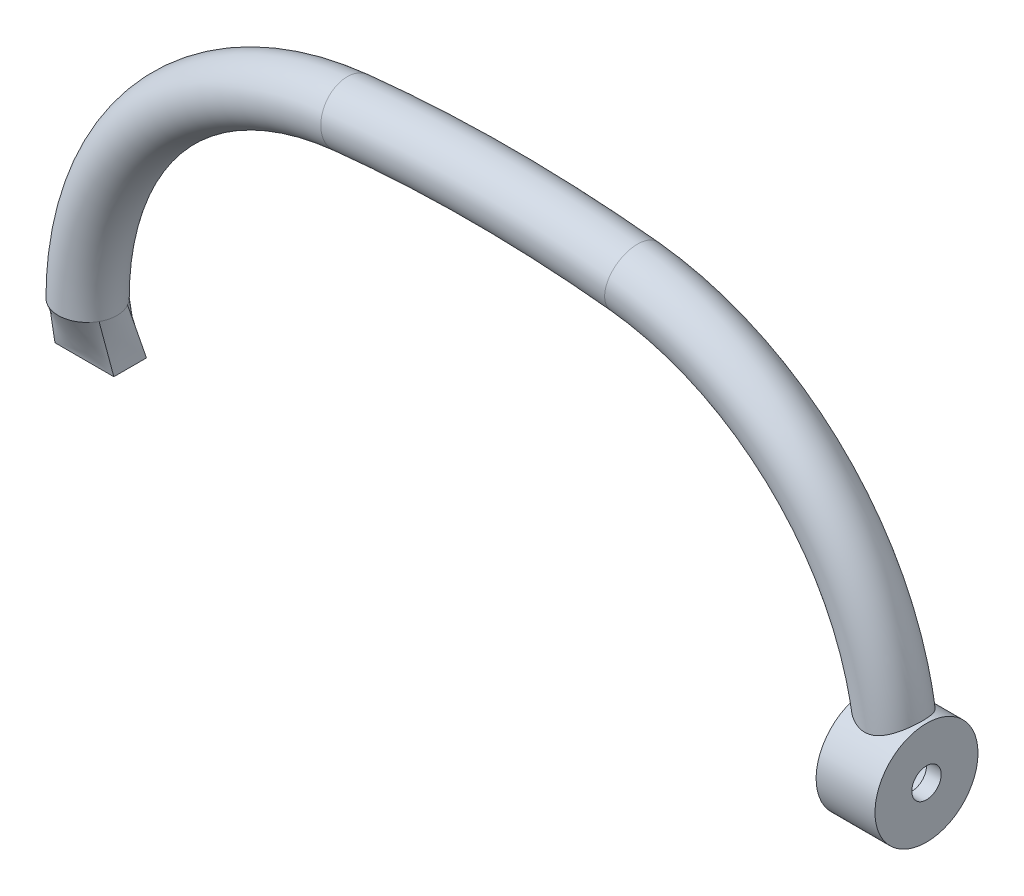
from build123d import *

# Parameters (mm, degrees)
ESQUISSE2_R                  = 2
BOSS_EXTRU_1_START           = 18
ESQUISSE3_R                  = 3.5
BOSS_EXTRU_1_DEPTH           = 4
ESQUISSE4_R                  = 1
ENL_V_MAT_EXTRU_1_DEPTH      = 4
ENL_V_MAT_EXTRU_2_DEPTH      = 3
ENL_V_MAT_EXTRU_2_DEPTH_BACK = 3
ESQUISSE5_R                  = 2.5


with BuildPart() as part:
    # Balayage1: sweep along a path in Esquisse1
    with BuildLine(Plane.XY) as balayage1_path:
        ThreePointArc((20, 0), (14.880476183, 13.363062096), (2.142857143, 19.884872724))
        ThreePointArc((2.142857143, 19.884872724), (-7.5, 20.402945465), (-17.142857143, 19.884872724))
        ThreePointArc((-17.142857143, 19.884872724), (-29.880476183, 13.363062096), (-35, 0))
    # Esquisse2 → Balayage1 (sweep)
    with BuildSketch(Plane(origin=(0, 0, 0), x_dir=(1, 0, 0), z_dir=(0, 1, 0))):
        with Locations((-35, 0)):
            Circle(ESQUISSE2_R)
    sweep(path=balayage1_path.line)

    # Esquisse3 → Boss.-Extru.1 (add)
    with BuildSketch(Plane(origin=(0, 0, 0), x_dir=(0, 0, -1), z_dir=(1, 0, 0)).offset(BOSS_EXTRU_1_START)):
        with Locations(Location((0, 0, 0), (0, 0, 107.690863125))):
            Circle(ESQUISSE3_R)
    extrude(amount=BOSS_EXTRU_1_DEPTH)

    # Esquisse4 → Enlèv. mat.-Extru.1 (cut)
    with BuildSketch(Plane(origin=(22, 0, 0), x_dir=(0, 0, -1), z_dir=(1, 0, 0))):
        Circle(ESQUISSE4_R)
    extrude(amount=-ENL_V_MAT_EXTRU_1_DEPTH, mode=Mode.SUBTRACT)

    # Esquisse5 → Enlèv. mat.-Extru.2 (cut, two sides: drawn at the far end of the back side and taken through both)
    with BuildSketch(Plane.ZY.offset(-18).offset(-ENL_V_MAT_EXTRU_2_DEPTH_BACK)):
        with Locations(Location((0, 0, 0), (0, 0, 108.058622976))):
            Circle(ESQUISSE5_R)
    extrude(amount=ENL_V_MAT_EXTRU_2_DEPTH + ENL_V_MAT_EXTRU_2_DEPTH_BACK, mode=Mode.SUBTRACT)

    # Lissage1: read off the stored shape, not the designer's step
    # Lissage1: loft between two sections, ruled curve by curve
    lissage1_from = [
        Edge.make_bspline([(-36.749469355, 0, -0.969204301), (-36.678819637, 0, -1.096731094), (-36.589454865, 0, -1.225003052), (-36.368205496, 0, -1.467996241), (-36.236155441, 0, -1.582585979), (-35.932449234, 0, -1.778537905), (-35.760757814, 0, -1.859623663), (-35.392626028, 0, -1.97048152), (-35.196401592, 0, -2), (-34.803598408, 0, -2), (-34.607373972, 0, -1.97048152), (-34.239242186, 0, -1.859623663), (-34.067550766, 0, -1.778537905), (-33.763844559, 0, -1.582585979), (-33.631794504, 0, -1.467996241), (-33.410545135, 0, -1.225003052), (-33.321180363, 0, -1.096731094), (-33.250530645, 0, -0.969204301)], [0, 0, 0, 0, 0.125, 0.125, 0.25, 0.25, 0.375, 0.375, 0.5, 0.5, 0.625, 0.625, 0.75, 0.75, 0.875, 0.875, 1, 1, 1, 1], 3),
        Edge.make_bspline([(-33.250530645, 0, -0.969204301), (-33.172250897, 0, -0.827904866), (-33.108813179, 0, -0.672414541), (-33.022626455, 0, -0.344561707), (-33, 0, -0.172327372), (-33, 0, 0.172327372), (-33.022626455, 0, 0.344561707), (-33.108813179, 0, 0.672414541), (-33.172250897, 0, 0.827904866), (-33.250530645, 0, 0.969204301)], [0, 0, 0, 0, 0.25, 0.25, 0.5, 0.5, 0.75, 0.75, 1, 1, 1, 1], 3),
        Edge.make_bspline([(-36.749469355, 0, 0.969204301), (-36.827749103, 0, 0.827904866), (-36.891186821, 0, 0.672414541), (-36.977373545, 0, 0.344561707), (-37, 0, 0.172327372), (-37, 0, -0.172327372), (-36.977373545, 0, -0.344561707), (-36.891186821, 0, -0.672414541), (-36.827749103, 0, -0.827904866), (-36.749469355, 0, -0.969204301)], [0, 0, 0, 0, 0.25, 0.25, 0.5, 0.5, 0.75, 0.75, 1, 1, 1, 1], 3),
        Edge.make_bspline([(-33.250530645, 0, 0.969204301), (-33.321180363, 0, 1.096731094), (-33.410545135, 0, 1.225003052), (-33.631794504, 0, 1.467996241), (-33.763844559, 0, 1.582585979), (-34.067550766, 0, 1.778537905), (-34.239242186, 0, 1.859623663), (-34.607373972, 0, 1.97048152), (-34.803598408, 0, 2), (-35.196401592, 0, 2), (-35.392626028, 0, 1.97048152), (-35.760757814, 0, 1.859623663), (-35.932449234, 0, 1.778537905), (-36.236155441, 0, 1.582585979), (-36.368205496, 0, 1.467996241), (-36.589454865, 0, 1.225003052), (-36.678819637, 0, 1.096731094), (-36.749469355, 0, 0.969204301)], [0, 0, 0, 0, 0.125, 0.125, 0.25, 0.25, 0.375, 0.375, 0.5, 0.5, 0.625, 0.625, 0.75, 0.75, 0.875, 0.875, 1, 1, 1, 1], 3),
    ]
    lissage1_to = [
        Edge.make_bspline([(-37, -3.5, -2), (-36.833333333, -3.5, -2), (-36.666666667, -3.5, -2), (-36.333333333, -3.5, -2), (-36.166666667, -3.5, -2), (-35.833333333, -3.5, -2), (-35.666666667, -3.5, -2), (-35.333333333, -3.5, -2), (-35.166666667, -3.5, -2), (-34.833333333, -3.5, -2), (-34.666666667, -3.5, -2), (-34.333333333, -3.5, -2), (-34.166666667, -3.5, -2), (-33.833333333, -3.5, -2), (-33.666666667, -3.5, -2), (-33.333333333, -3.5, -2), (-33.166666667, -3.5, -2), (-33, -3.5, -2)], [0, 0, 0, 0, 0.125, 0.125, 0.25, 0.25, 0.375, 0.375, 0.5, 0.5, 0.625, 0.625, 0.75, 0.75, 0.875, 0.875, 1, 1, 1, 1], 3),
        Edge.make_bspline([(-33, -3.5, -2), (-33, -3.5, -1.815333661), (-33, -3.5, -1.630667323), (-33, -3.5, -1.261334645), (-33, -3.5, -1.076668307), (-33, -3.5, -0.707335629), (-33, -3.5, -0.52266929), (-33, -3.5, -0.153336613), (-33, -3.5, 0.031329726), (-33, -3.5, 0.215996064)], [0, 0, 0, 0, 0.25, 0.25, 0.5, 0.5, 0.75, 0.75, 1, 1, 1, 1], 3),
        Edge.make_bspline([(-37, -3.5, 0.215996064), (-37, -3.5, 0.031329726), (-37, -3.5, -0.153336613), (-37, -3.5, -0.52266929), (-37, -3.5, -0.707335629), (-37, -3.5, -1.076668307), (-37, -3.5, -1.261334645), (-37, -3.5, -1.630667323), (-37, -3.5, -1.815333661), (-37, -3.5, -2)], [0, 0, 0, 0, 0.25, 0.25, 0.5, 0.5, 0.75, 0.75, 1, 1, 1, 1], 3),
        Edge.make_bspline([(-33, -3.5, 0.215996064), (-33.166666667, -3.5, 0.215996064), (-33.333333333, -3.5, 0.215996064), (-33.666666667, -3.5, 0.215996064), (-33.833333333, -3.5, 0.215996064), (-34.166666667, -3.5, 0.215996064), (-34.333333333, -3.5, 0.215996064), (-34.666666667, -3.5, 0.215996064), (-34.833333333, -3.5, 0.215996064), (-35.166666667, -3.5, 0.215996064), (-35.333333333, -3.5, 0.215996064), (-35.666666667, -3.5, 0.215996064), (-35.833333333, -3.5, 0.215996064), (-36.166666667, -3.5, 0.215996064), (-36.333333333, -3.5, 0.215996064), (-36.666666667, -3.5, 0.215996064), (-36.833333333, -3.5, 0.215996064), (-37, -3.5, 0.215996064)], [0, 0, 0, 0, 0.125, 0.125, 0.25, 0.25, 0.375, 0.375, 0.5, 0.5, 0.625, 0.625, 0.75, 0.75, 0.875, 0.875, 1, 1, 1, 1], 3),
    ]
    lissage1 = Solid(Shell([*[Face.make_surface_from_curves(lissage1_from[k], lissage1_to[k]) for k in range(4)], Face(Wire(lissage1_from)), Face(Wire(lissage1_to))]))
    add(lissage1)


solid = part.part
